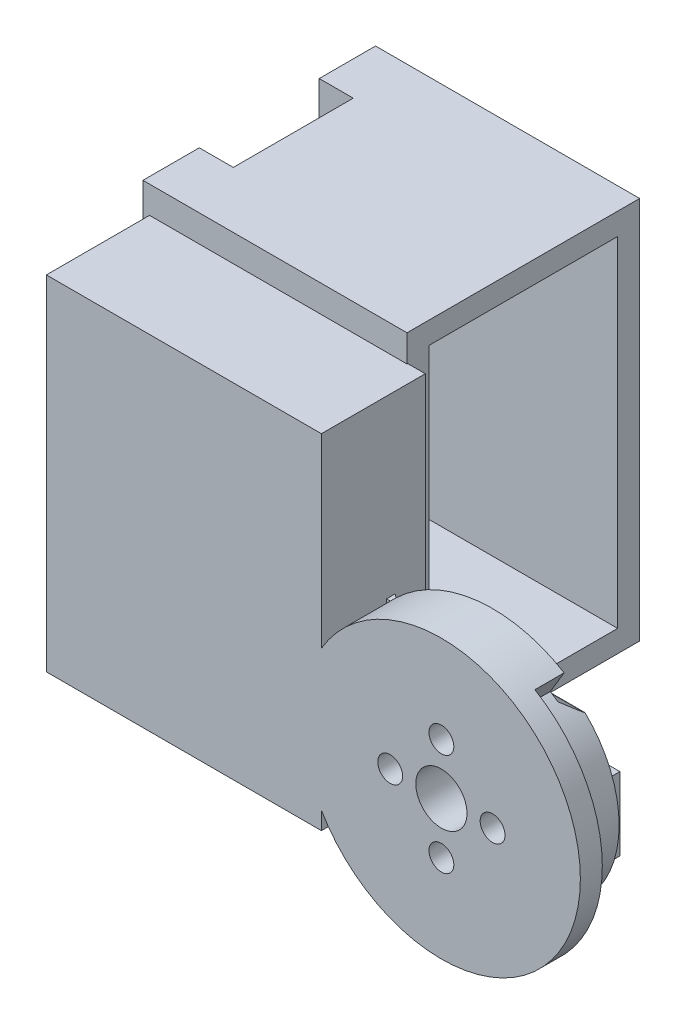
from build123d import *
from build123d.topology import SkipClean

# Parameters (mm, degrees)
S_CYL1_R        = 19
BOSS_1_DEPTH    = 7
BOSS_2_DEPTH    = 2.1
S_BOX3_W        = 28.2
S_BOX3_H        = 10
BOSS_3_DEPTH    = 1.5
S_BOX4_W        = 37.6
S_BOX4_H        = 47
BOSS_4_DEPTH    = 14.2
BOSS_5_DEPTH    = 23
BOSS_6_DEPTH    = 22
S_BOX7_W        = 36.1
S_BOX7_H        = 3
BOSS_7_DEPTH    = 31.8
S_BOX8_W        = 36.1
S_BOX8_H        = 3
BOSS_8_DEPTH    = 31.8
S_BOX9_W        = 36.1
S_BOX9_H        = 52.4
BOSS_9_DEPTH    = 3
S_BOX10_W       = 36.1
S_BOX10_H       = 52.4
BOSS_10_DEPTH   = 3
S_BOX11_W       = 4.6
S_BOX11_H       = 52.4
BOSS_11_DEPTH   = 31.8
S_HOLE12_R      = 10.5
HOLE_12_DEPTH   = 4.8
S_CUT13_W       = 4.75
S_CUT13_H       = 19.5
POCKET_13_DEPTH = 19.4
S_CUT14_W       = 4.75
S_CUT14_H       = 8.8
POCKET_14_DEPTH = 16.4
S_CUT15_W       = 4.75
S_CUT15_H       = 11
POCKET_15_DEPTH = 7
S_CUT16_W       = 2.9
S_CUT16_H       = 20
POCKET_16_DEPTH = 16.4
S_HOLE17_R      = 1.1
HOLE_17_DEPTH   = 4.8
S_HOLE18_R      = 2.3
HOLE_18_DEPTH   = 1.7
S_HOLE19_R      = 1.1
HOLE_19_DEPTH   = 4.8
S_HOLE20_R      = 2.3
HOLE_20_DEPTH   = 1.7
S_HOLE21_R      = 1.1
HOLE_21_DEPTH   = 4.8
S_HOLE22_R      = 2.3
HOLE_22_DEPTH   = 1.7
CUT_23_DEPTH    = 6.1
S_HOLE24_R      = 3.5
HOLE_24_DEPTH   = 10.6
S_HOLE25_R      = 1.7
HOLE_25_DEPTH   = 10.6
S_HOLE26_R      = 1.7
HOLE_26_DEPTH   = 10.6
S_HOLE27_R      = 1.7
HOLE_27_DEPTH   = 10.6
S_HOLE28_R      = 1.7
HOLE_28_DEPTH   = 10.6
S_HOLE29_R      = 3.2
HOLE_29_DEPTH   = 7.6
S_HOLE30_R      = 3.2
HOLE_30_DEPTH   = 7.6
S_HOLE31_R      = 3.2
HOLE_31_DEPTH   = 7.6
S_HOLE32_R      = 3.2
HOLE_32_DEPTH   = 7.6


with BuildPart() as part:
    # S_cyl1 → Boss_1 (new body)
    with BuildSketch(Plane.XY.offset(23)):
        Circle(S_CYL1_R)
    extrude(amount=BOSS_1_DEPTH)

    # S_prism2 → Boss_2 (add)
    with SkipClean():  # the faces are left unmerged after this step: merging them gives an invalid solid
        with BuildSketch(Plane.XY.offset(21)):
            with BuildLine():
                Line((-15.491933385, 11), (15.491933385, 11))
                ThreePointArc((15.491933385, 11), (19, 0), (15.491933385, -11))
                Line((15.491933385, -11), (-15.491933385, -11))
                ThreePointArc((-15.491933385, -11), (-19, 0), (-15.491933385, 11))
            make_face()
        extrude(amount=BOSS_2_DEPTH)

    # S_box3 → Boss_3 (add)
    with SkipClean():  # the faces are left unmerged after this step: merging them gives an invalid solid
        with BuildSketch(Plane.XY.offset(19.6)):
            with Locations((-0.1, 0)):
                Rectangle(S_BOX3_W, S_BOX3_H)
        extrude(amount=BOSS_3_DEPTH)

    # S_box4 → Boss_4 (add)
    with SkipClean():  # the faces are left unmerged after this step: merging them gives an invalid solid
        with BuildSketch(Plane.XY.offset(15.8)):
            with Locations((-35.2, 11.5)):
                Rectangle(S_BOX4_W, S_BOX4_H)
        extrude(amount=BOSS_4_DEPTH)

    # S_prism5 → Boss_5 (add)
    with SkipClean():  # the faces are left unmerged after this step: merging them gives an invalid solid
        with BuildSketch(Plane(origin=(-11.5, 0, 0), x_dir=(0, 0, -1), z_dir=(1, 0, 0))):
            Polygon((-21.05, 11), (-21.05, -12), (-23.1, -15), (-23.1, 12.5), align=None)
        extrude(amount=BOSS_5_DEPTH)

    # S_prism6 → Boss_6 (add)
    with SkipClean():  # the faces are left unmerged after this step: merging them gives an invalid solid
        with BuildSketch(Plane(origin=(0, -11, 0), x_dir=(1, 0, 0), z_dir=(0, 1, 0))):
            Polygon((-16.45, -21.1), (-16.45, -19.9), (-14.8, -21.1), align=None)
        extrude(amount=BOSS_6_DEPTH)

    # S_box8 → Boss_8 (add)
    with SkipClean():  # the faces are left unmerged after this step: merging them gives an invalid solid
        with BuildSketch(Plane.XY.offset(-15.9)):
            with Locations((-36.85, -12.2)):
                Rectangle(S_BOX8_W, S_BOX8_H)
        extrude(amount=BOSS_8_DEPTH)



with BuildPart() as body_2:
    # S_box7 → Boss_7 (new body)
    with BuildSketch(Plane.XY.offset(-15.9)):
        with Locations((-36.85, 37.2)):
            Rectangle(S_BOX7_W, S_BOX7_H)
    extrude(amount=BOSS_7_DEPTH)


with BuildPart() as part_1:
    with SkipClean():  # the faces are left unmerged after this step: merging them gives an invalid solid
        add(part.part)

        add(body_2.part)  # Boss_9 merges body 2
        # S_box9 → Boss_9 (add)
        with BuildSketch(Plane.XY.offset(-15.9)):
            with Locations((-36.85, 12.5)):
                Rectangle(S_BOX9_W, S_BOX9_H)
        extrude(amount=BOSS_9_DEPTH)

    # S_box10 → Boss_10 (add)
    with SkipClean():  # the faces are left unmerged after this step: merging them gives an invalid solid
        with BuildSketch(Plane.XY.offset(12.9)):
            with Locations((-36.85, 12.5)):
                Rectangle(S_BOX10_W, S_BOX10_H)
        extrude(amount=BOSS_10_DEPTH)

    # S_box11 → Boss_11 (add)
    with SkipClean():  # the faces are left unmerged after this step: merging them gives an invalid solid
        with BuildSketch(Plane.XY.offset(-15.9)):
            with Locations((-52.6, 12.5)):
                Rectangle(S_BOX11_W, S_BOX11_H)
        extrude(amount=BOSS_11_DEPTH)

    # S_hole12 → Hole_12 (cut)
    with SkipClean():  # the faces are left unmerged after this step: merging them gives an invalid solid
        with BuildSketch(Plane(origin=(-55, 0, 0), x_dir=(0, 0, -1), z_dir=(1, 0, 0))):
            Circle(S_HOLE12_R)
        extrude(amount=HOLE_12_DEPTH, mode=Mode.SUBTRACT)

    # S_cut13 → Pocket_13 (cut)
    with SkipClean():  # the faces are left unmerged after this step: merging them gives an invalid solid
        with BuildSketch(Plane.XY.offset(-9.7)):
            with Locations((-52.625, 20.65)):
                Rectangle(S_CUT13_W, S_CUT13_H)
        extrude(amount=POCKET_13_DEPTH, mode=Mode.SUBTRACT)

    # S_cut14 → Pocket_14 (cut)
    with SkipClean():  # the faces are left unmerged after this step: merging them gives an invalid solid
        with BuildSketch(Plane.XY.offset(-8.2)):
            with Locations((-52.625, 34.8)):
                Rectangle(S_CUT14_W, S_CUT14_H)
        extrude(amount=POCKET_14_DEPTH, mode=Mode.SUBTRACT)

    # S_cut15 → Pocket_15 (cut)
    with SkipClean():  # the faces are left unmerged after this step: merging them gives an invalid solid
        with BuildSketch(Plane.XY.offset(-3.5)):
            with Locations((-52.625, 5.5)):
                Rectangle(S_CUT15_W, S_CUT15_H)
        extrude(amount=POCKET_15_DEPTH, mode=Mode.SUBTRACT)

    # S_cut16 → Pocket_16 (cut)
    with SkipClean():  # the faces are left unmerged after this step: merging them gives an invalid solid
        with BuildSketch(Plane.XY.offset(-16.4)):
            with Locations((-53.65, 0)):
                Rectangle(S_CUT16_W, S_CUT16_H)
        extrude(amount=POCKET_16_DEPTH, mode=Mode.SUBTRACT)

    # S_hole17 → Hole_17 (cut)
    with SkipClean():  # the faces are left unmerged after this step: merging them gives an invalid solid
        with BuildSketch(Plane(origin=(-55, 0, 0), x_dir=(0, 0, -1), z_dir=(1, 0, 0))):
            with Locations((-10.25, 8.3)):
                Circle(S_HOLE17_R)
        extrude(amount=HOLE_17_DEPTH, mode=Mode.SUBTRACT)

    # S_hole18 → Hole_18 (cut)
    with SkipClean():  # the faces are left unmerged after this step: merging them gives an invalid solid
        with BuildSketch(Plane(origin=(-55, 0, 0), x_dir=(0, 0, -1), z_dir=(1, 0, 0))):
            with Locations((-10.25, 8.3)):
                Circle(S_HOLE18_R)
        extrude(amount=HOLE_18_DEPTH, mode=Mode.SUBTRACT)

    # S_hole19 → Hole_19 (cut)
    with SkipClean():  # the faces are left unmerged after this step: merging them gives an invalid solid
        with BuildSketch(Plane(origin=(-55, 0, 0), x_dir=(0, 0, -1), z_dir=(1, 0, 0))):
            with Locations((10.25, 32.75)):
                Circle(S_HOLE19_R)
        extrude(amount=HOLE_19_DEPTH, mode=Mode.SUBTRACT)

    # S_hole20 → Hole_20 (cut)
    with SkipClean():  # the faces are left unmerged after this step: merging them gives an invalid solid
        with BuildSketch(Plane(origin=(-55, 0, 0), x_dir=(0, 0, -1), z_dir=(1, 0, 0))):
            with Locations((10.25, 32.75)):
                Circle(S_HOLE20_R)
        extrude(amount=HOLE_20_DEPTH, mode=Mode.SUBTRACT)

    # S_hole21 → Hole_21 (cut)
    with SkipClean():  # the faces are left unmerged after this step: merging them gives an invalid solid
        with BuildSketch(Plane(origin=(-55, 0, 0), x_dir=(0, 0, -1), z_dir=(1, 0, 0))):
            with Locations((-10.25, 32.75)):
                Circle(S_HOLE21_R)
        extrude(amount=HOLE_21_DEPTH, mode=Mode.SUBTRACT)

    # S_hole22 → Hole_22 (cut)
    with SkipClean():  # the faces are left unmerged after this step: merging them gives an invalid solid
        with BuildSketch(Plane(origin=(-55, 0, 0), x_dir=(0, 0, -1), z_dir=(1, 0, 0))):
            with Locations((-10.25, 32.75)):
                Circle(S_HOLE22_R)
        extrude(amount=HOLE_22_DEPTH, mode=Mode.SUBTRACT)

    # S_pcut23 → Cut_23 (cut)
    with BuildSketch(Plane.XY.offset(20.9)):
        with BuildLine():
            Line((-14.792307772, -12.858756968), (-11.547056577, -10.037703144))
            ThreePointArc((-11.547056577, -10.037703144), (11.72047998, -9.834650428), (7.880082546, 13.114659701))
            Line((7.880082546, 13.114659701), (10.094746268, 16.800479094))
            ThreePointArc((10.094746268, 16.800479094), (15.014471085, -12.59863715), (-14.792307772, -12.858756968))
        make_face()
    extrude(amount=CUT_23_DEPTH, mode=Mode.SUBTRACT)

    # S_hole24 → Hole_24 (cut)
    with BuildSketch(Plane.XY.offset(19.5)):
        Circle(S_HOLE24_R)
    extrude(amount=HOLE_24_DEPTH, mode=Mode.SUBTRACT)

    # S_hole25 → Hole_25 (cut)
    with BuildSketch(Plane.XY.offset(19.5)):
        with Locations((7, 0)):
            Circle(S_HOLE25_R)
    extrude(amount=HOLE_25_DEPTH, mode=Mode.SUBTRACT)

    # S_hole26 → Hole_26 (cut)
    with BuildSketch(Plane.XY.offset(19.5)):
        with Locations((0, -7)):
            Circle(S_HOLE26_R)
    extrude(amount=HOLE_26_DEPTH, mode=Mode.SUBTRACT)

    # S_hole27 → Hole_27 (cut)
    with BuildSketch(Plane.XY.offset(19.5)):
        with Locations((-7, 0)):
            Circle(S_HOLE27_R)
    extrude(amount=HOLE_27_DEPTH, mode=Mode.SUBTRACT)

    # S_hole28 → Hole_28 (cut)
    with BuildSketch(Plane.XY.offset(19.5)):
        with Locations((0, 7)):
            Circle(S_HOLE28_R)
    extrude(amount=HOLE_28_DEPTH, mode=Mode.SUBTRACT)

    # S_hole29 → Hole_29 (cut)
    with BuildSketch(Plane.XY.offset(19.4)):
        with Locations((7, 0)):
            Circle(S_HOLE29_R)
    extrude(amount=HOLE_29_DEPTH, mode=Mode.SUBTRACT)

    # S_hole30 → Hole_30 (cut)
    with BuildSketch(Plane.XY.offset(19.4)):
        with Locations((0, -7)):
            Circle(S_HOLE30_R)
    extrude(amount=HOLE_30_DEPTH, mode=Mode.SUBTRACT)

    # S_hole31 → Hole_31 (cut)
    with BuildSketch(Plane.XY.offset(19.4)):
        with Locations((-7, 0)):
            Circle(S_HOLE31_R)
    extrude(amount=HOLE_31_DEPTH, mode=Mode.SUBTRACT)

    # S_hole32 → Hole_32 (cut)
    with BuildSketch(Plane.XY.offset(19.4)):
        with Locations((0, 7)):
            Circle(S_HOLE32_R)
    extrude(amount=HOLE_32_DEPTH, mode=Mode.SUBTRACT)


solid = part_1.part
